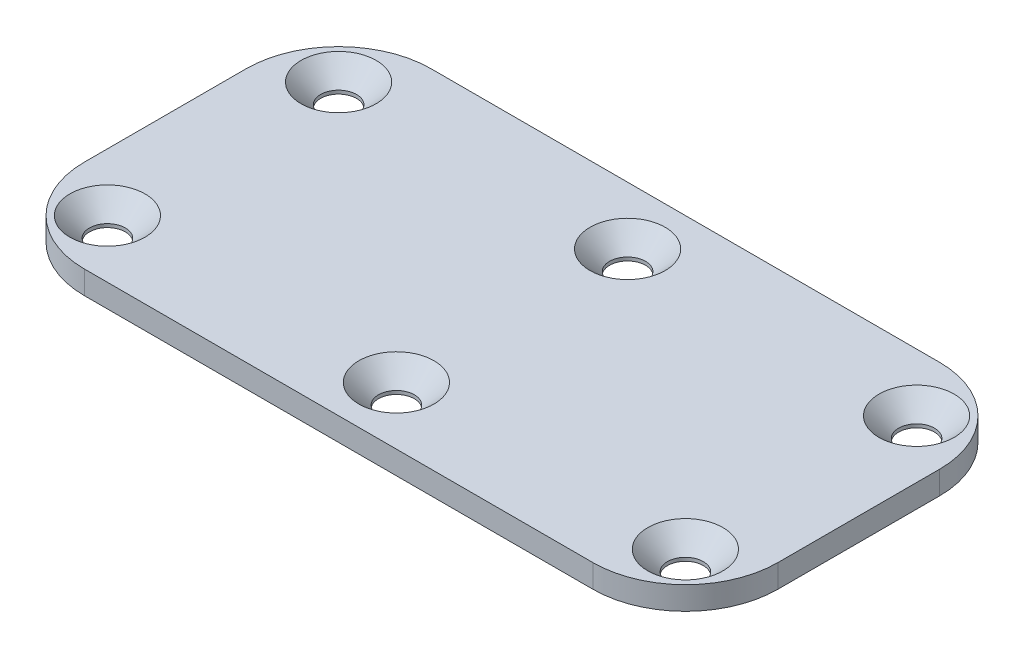
from build123d import *

# Parameters (mm, degrees)
BOSS_EXTRUDE1_DEPTH                 = 2
F_3_1_3_1_DIAMETER_HOLE1_AT_2_COUNT = 2
F_3_1_3_1_DIAMETER_HOLE1_AT_2_PITCH = 20
F_3_1_3_1_DIAMETER_HOLE1_AT_3_COUNT = 2
F_3_1_3_1_DIAMETER_HOLE1_AT_3_PITCH = 53.851648071
F_3_1_3_1_DIAMETER_HOLE1_AT_4_COUNT = 2
F_3_1_3_1_DIAMETER_HOLE1_AT_4_PITCH = 50
F_3_1_3_1_DIAMETER_HOLE1_AT_5_COUNT = 2
F_3_1_3_1_DIAMETER_HOLE1_AT_5_PITCH = 25
F_3_1_3_1_DIAMETER_HOLE1_AT_6_COUNT = 2
F_3_1_3_1_DIAMETER_HOLE1_AT_6_PITCH = 32.015621187


with BuildPart() as part:
    # Sketch1 → Boss-Extrude1 (new body)
    with BuildSketch(Plane(origin=(0, 0, 0), x_dir=(1, 0, 0), z_dir=(0, 1, 0))):
        with BuildLine():
            Line((22, -15), (-22, -15))
            ThreePointArc((-22, -15), (-27.656854249, -12.656854249), (-30, -7))
            Line((-30, -7), (-30, 7))
            ThreePointArc((-30, 7), (-27.656854249, 12.656854249), (-22, 15))
            Line((-22, 15), (22, 15))
            ThreePointArc((22, 15), (27.656854249, 12.656854249), (30, 7))
            Line((30, 7), (30, -7))
            ThreePointArc((30, -7), (27.656854249, -12.656854249), (22, -15))
        make_face()
    extrude(amount=BOSS_EXTRUDE1_DEPTH)

    # Sketch3 → Ø3.1 (3.1) Diameter Hole1 (revolve, cut)
    with BuildSketch(Plane(origin=(25, 2, -10), x_dir=(0, 0, 1), z_dir=(1, 0, 0))):
        Polygon((0, 0), (0, 2), (1.55, 2), (1.55, 1.7), (3.25, 0), align=None)
    f_3_1_3_1_diameter_hole1 = revolve(axis=Axis((25, 8.35, -10), (0, -1, 0)), mode=Mode.SUBTRACT)

    # Ø3.1 (3.1) Diameter Hole1 at 2: Ø3.1 (3.1) Diameter Hole1 ×2
    with Locations(*[(0, 0, i * F_3_1_3_1_DIAMETER_HOLE1_AT_2_PITCH) for i in range(1, F_3_1_3_1_DIAMETER_HOLE1_AT_2_COUNT)]):
        add(f_3_1_3_1_diameter_hole1, mode=Mode.SUBTRACT)

    # Ø3.1 (3.1) Diameter Hole1 at 3: Ø3.1 (3.1) Diameter Hole1 ×2
    with Locations(*[Vector(-0.9284766908852593, 0, 0.3713906763541038) * (i * F_3_1_3_1_DIAMETER_HOLE1_AT_3_PITCH) for i in range(1, F_3_1_3_1_DIAMETER_HOLE1_AT_3_COUNT)]):
        add(f_3_1_3_1_diameter_hole1, mode=Mode.SUBTRACT)

    # Ø3.1 (3.1) Diameter Hole1 at 4: Ø3.1 (3.1) Diameter Hole1 ×2
    with Locations(*[(-i * F_3_1_3_1_DIAMETER_HOLE1_AT_4_PITCH, 0, 0) for i in range(1, F_3_1_3_1_DIAMETER_HOLE1_AT_4_COUNT)]):
        add(f_3_1_3_1_diameter_hole1, mode=Mode.SUBTRACT)

    # Ø3.1 (3.1) Diameter Hole1 at 5: Ø3.1 (3.1) Diameter Hole1 ×2
    with Locations(*[(-i * F_3_1_3_1_DIAMETER_HOLE1_AT_5_PITCH, 0, 0) for i in range(1, F_3_1_3_1_DIAMETER_HOLE1_AT_5_COUNT)]):
        add(f_3_1_3_1_diameter_hole1, mode=Mode.SUBTRACT)

    # Ø3.1 (3.1) Diameter Hole1 at 6: Ø3.1 (3.1) Diameter Hole1 ×2
    with Locations(*[Vector(-0.7808688094430304, 0, 0.6246950475544244) * (i * F_3_1_3_1_DIAMETER_HOLE1_AT_6_PITCH) for i in range(1, F_3_1_3_1_DIAMETER_HOLE1_AT_6_COUNT)]):
        add(f_3_1_3_1_diameter_hole1, mode=Mode.SUBTRACT)


solid = part.part
